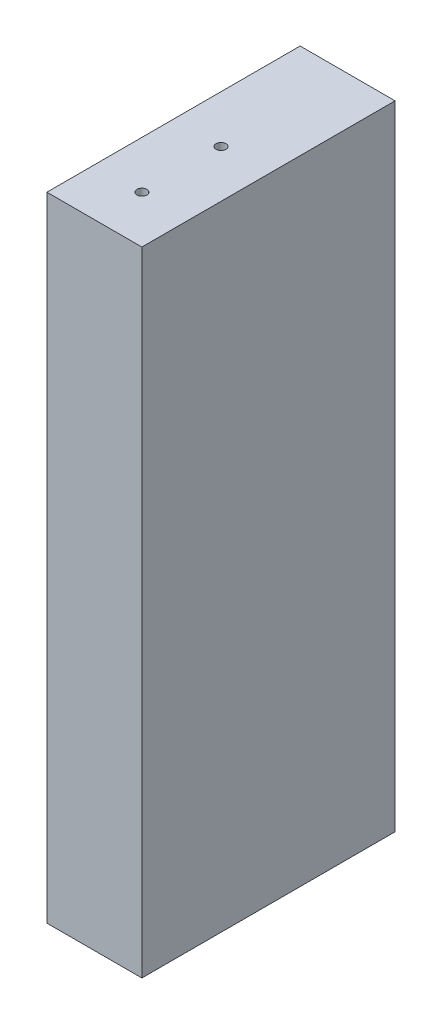
from build123d import *

# Parameters (mm, degrees)
SKETCH1_W                           = 19.05
SKETCH1_H                           = 126.999999888
BOSS_EXTRUDE1_DEPTH                 = 50.8
F_5_64_0_07813_DIAMETER_HOLE1_D     = 1.984502
F_5_64_0_07813_DIAMETER_HOLE1_DEPTH = 38.1
F_5_64_0_07813_DIAMETER_HOLE1_TIP   = 0.59620455
F_5_64_0_07813_DIAMETER_HOLE6_D     = 1.984502
F_5_64_0_07813_DIAMETER_HOLE6_DEPTH = 19.05
F_5_64_0_07813_DIAMETER_HOLE6_TIP   = 0.59620455
F_5_64_0_07813_DIAMETER_HOLE7_D     = 1.984502
F_5_64_0_07813_DIAMETER_HOLE7_DEPTH = 19.05
F_5_64_0_07813_DIAMETER_HOLE7_TIP   = 0.59620455


with BuildPart() as part:
    # Sketch1 → Boss-Extrude1 (new body)
    with BuildSketch(Plane.XY):
        with Locations((377.144680647, 6006.134818763)):
            Rectangle(SKETCH1_W, SKETCH1_H)
    extrude(amount=BOSS_EXTRUDE1_DEPTH)

    # 5/64 (0.07813) Diameter Hole1
    with Locations(Plane(origin=(-83.853965539, -12.395181178, -19.050087596), x_dir=(-1, 0, 0), z_dir=(0, 1.3770507333441827e-10, -1.0))):
        with Locations((-481.589248274, 6993.254992531), (-386.339248274, 6993.254992531), (-291.089248274, 6993.254992531), (-295.274999999, 6965.135938475), (-295.274999999, 6812.735938475), (-295.274999999, 6660.335938474), (-285.166362357, 6631.468843414), (-475.477307398, 6631.468752771), (-485.002307398, 6660.335938474), (-485.002307398, 6812.735938474), (-485.002307398, 6965.135938474), (-478.365617646, 6611.6708), (-287.865617646, 6611.6708), (-307.975, 6564.3379), (-307.975, 6488.1379), (-284.960913066, 6440.805), (-380.210913066, 6440.805), (-475.460913066, 6440.805), (-446.831312422, 6488.1379), (-446.831312422, 6564.3379), (-472.231312422, 6396.355), (-472.231312422, 6320.155), (-472.653156211, 6275.705000839), (-377.403156211, 6275.705000839), (-282.153156211, 6275.705000839), (-282.575, 6320.155), (-282.575, 6396.355), (-435.598646187, 6221.729999816), (-435.598646187, 6145.529999816), (-450.592518112, 6091.554999951), (-460.998646187, 6091.555478285), (-460.998646187, 6056.629999944), (-460.998646187, 5980.429999944), (-460.998646187, 5945.505000042), (-282.153156211, 5945.505000042), (-368.611823093, 5945.505000042)):
            Hole(F_5_64_0_07813_DIAMETER_HOLE1_D / 2, depth=F_5_64_0_07813_DIAMETER_HOLE1_DEPTH)
            with Locations((0, 0, -(F_5_64_0_07813_DIAMETER_HOLE1_DEPTH + F_5_64_0_07813_DIAMETER_HOLE1_TIP / 2))):  # 118° drill point
                Cone(0, F_5_64_0_07813_DIAMETER_HOLE1_D / 2, F_5_64_0_07813_DIAMETER_HOLE1_TIP, mode=Mode.SUBTRACT)

    # 5/64 (0.07813) Diameter Hole6
    with Locations(Plane(origin=(0, 5942.634818819, 0), x_dir=(-1, 0, 0), z_dir=(0, -1, 0))):
        with Locations((-377.144680647, -41.274997961), (-377.144680647, -25.399997961)):
            Hole(F_5_64_0_07813_DIAMETER_HOLE6_D / 2, depth=F_5_64_0_07813_DIAMETER_HOLE6_DEPTH)
            with Locations((0, 0, -(F_5_64_0_07813_DIAMETER_HOLE6_DEPTH + F_5_64_0_07813_DIAMETER_HOLE6_TIP / 2))):  # 118° drill point
                Cone(0, F_5_64_0_07813_DIAMETER_HOLE6_D / 2, F_5_64_0_07813_DIAMETER_HOLE6_TIP, mode=Mode.SUBTRACT)

    # 5/64 (0.07813) Diameter Hole7
    with Locations(Plane(origin=(0, 6069.634818707, 0), x_dir=(1, 0, 0), z_dir=(0, 1, 0))):
        with Locations((377.144680647, -41.274997961), (377.144680647, -25.399997961)):
            Hole(F_5_64_0_07813_DIAMETER_HOLE7_D / 2, depth=F_5_64_0_07813_DIAMETER_HOLE7_DEPTH)
            with Locations((0, 0, -(F_5_64_0_07813_DIAMETER_HOLE7_DEPTH + F_5_64_0_07813_DIAMETER_HOLE7_TIP / 2))):  # 118° drill point
                Cone(0, F_5_64_0_07813_DIAMETER_HOLE7_D / 2, F_5_64_0_07813_DIAMETER_HOLE7_TIP, mode=Mode.SUBTRACT)


solid = part.part
